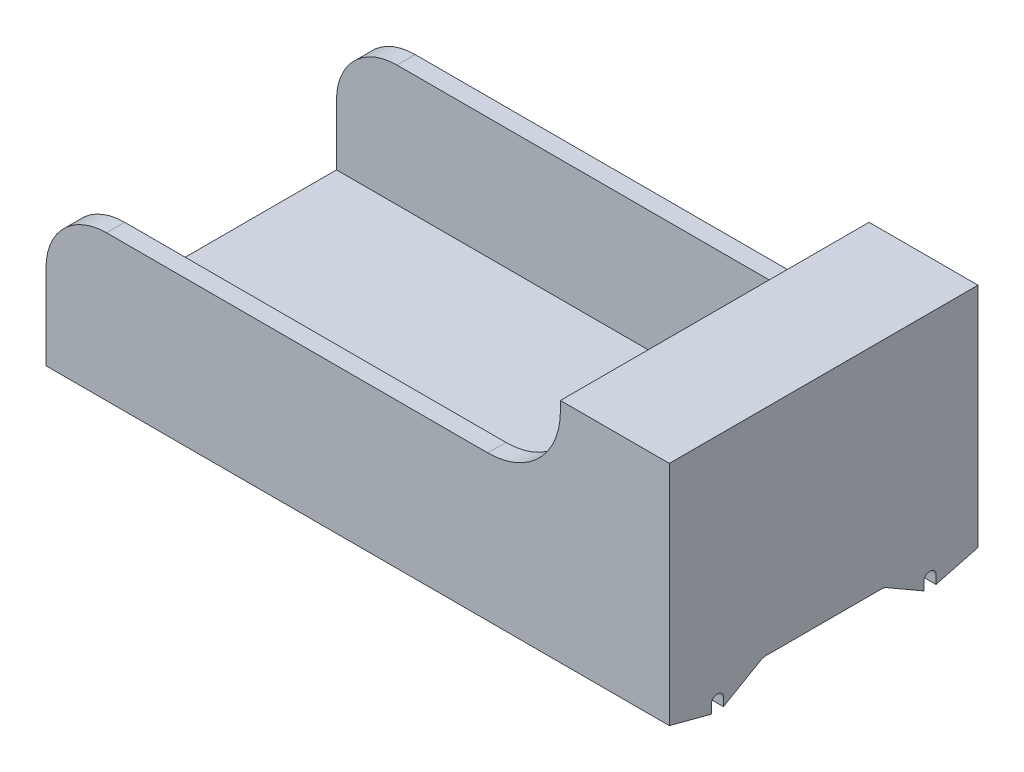
from build123d import *

# Parameters (mm, degrees)
SKETCH1_W                = 100
SKETCH1_H                = 45
BOSS_EXTRUDE1_DEPTH      = 2
BOSS_EXTRUDE2_DEPTH      = 100
BOSS_EXTRUDE3_DEPTH      = 15
CHAMFER2_SIZE            = 2
BOSS_EXTRUDE4_DEPTH      = 3
BOSS_EXTRUDE4_DEPTH_BACK = 48
SKETCH4_W                = 3
SKETCH4_H                = 35.5
BOSS_EXTRUDE6_DEPTH      = 103
CUT_EXTRUDE1_DEPTH       = 108
FILLET1_R                = 12
FILLET2_R                = 10


# Read off the part's stored shape, not the designer's step: Boss-Extrude6
with BuildPart() as part:
    # Sketch1 → Boss-Extrude1 (new body)
    with BuildSketch(Plane(origin=(0, 0, 0), x_dir=(1, 0, 0), z_dir=(0, 1, 0))):
        with Locations((50, 22.5)):
            Rectangle(SKETCH1_W, SKETCH1_H)
    extrude(amount=BOSS_EXTRUDE1_DEPTH)

    # Sketch2 → Boss-Extrude2 (add)
    with BuildSketch(Plane.ZY):
        Polygon((0, 2), (0, 22), (3, 22), (3, 0), (0, 0), align=None)
        Polygon((-45, 2), (-45, 22), (-48, 22), (-48, 0), (-45, 0), align=None)
    extrude(amount=-BOSS_EXTRUDE2_DEPTH)

    # Sketch3 → Boss-Extrude3 (add)
    with BuildSketch(Plane(origin=(100, 0, 0), x_dir=(0, 0, -1), z_dir=(1, 0, 0))):
        Polygon((0, 22), (0, 32.5), (45, 32.5), (45, 22), (48, 22), (48, 35.5), (-3, 35.5), (-3, 22), align=None)
    extrude(amount=-BOSS_EXTRUDE3_DEPTH)

    # Chamfer2
    chamfer2_edges = [part.edges().sort_by_distance(p)[0] for p in [
        (85, 32.5, -22.5),
    ]]
    chamfer(chamfer2_edges, length=CHAMFER2_SIZE)

    # Sketch4 → Boss-Extrude4 (add, two sides: drawn at the far end of the back side and taken through both)
    with BuildSketch(Plane.XY.offset(-BOSS_EXTRUDE4_DEPTH_BACK)):
        with Locations((101.5, 17.75)):
            Rectangle(SKETCH4_W, SKETCH4_H)
    extrude(amount=BOSS_EXTRUDE4_DEPTH + BOSS_EXTRUDE4_DEPTH_BACK)

    # Boss-Extrude6 outline → Boss-Extrude6 (add)
    with BuildSketch(Plane.YZ):
        with BuildLine():
            Line((0, -48), (0, -31.964101615))
            ThreePointArc((0, -31.964101615), (-0.068148347, -32.481739705), (-0.267949192, -32.964101615))
            Line((-0.267949192, -32.964101615), (-3.78757632, -39.060274624))
            ThreePointArc((-3.78757632, -39.060274624), (-4.037826078, -39.794785514), (-3.989674587, -40.569261223))
            Line((-3.989674587, -40.569261223), (-2.034217014, -48))
            Line((-2.034217014, -48), (0, -48))
        make_face()
        with BuildLine():
            ThreePointArc((-3.989674587, -4.430738777), (-4.037826078, -5.205214486), (-3.78757632, -5.939725376))
            Line((-3.78757632, -5.939725376), (-0.267949192, -12.035898385))
            ThreePointArc((-0.267949192, -12.035898385), (-0.068148347, -12.518260295), (0, -13.035898385))
            Line((0, -13.035898385), (0, 3))
            Line((0, 3), (-2.034217014, 3))
            Line((-2.034217014, 3), (-3.989674587, -4.430738777))
        make_face()
    extrude(amount=BOSS_EXTRUDE6_DEPTH)

    # Sketch6 → Cut-Extrude1 (cut)
    with BuildSketch(Plane.ZY):
        with BuildLine():
            Line((-39.060274624, -3.78757632), (-39.060274624, -2.38757632))
            ThreePointArc((-39.060274624, -2.38757632), (-39.323878521, -1.751180217), (-39.960274624, -1.48757632))
            Line((-39.960274624, -1.48757632), (-40.160274624, -1.48757632))
            ThreePointArc((-40.160274624, -1.48757632), (-40.796670727, -1.751180217), (-41.060274624, -2.38757632))
            Line((-41.060274624, -2.38757632), (-41.060274624, -3.860460534))
            Line((-41.060274624, -3.860460534), (-41.060274624, -4.910280297))
            Line((-41.060274624, -4.910280297), (-39.060274624, -4.910280297))
            Line((-39.060274624, -4.910280297), (-39.060274624, -3.78757632))
        make_face()
        with BuildLine():
            Line((-5.939725376, -3.78757632), (-5.939725376, -2.38757632))
            ThreePointArc((-5.939725376, -2.38757632), (-5.676121479, -1.751180217), (-5.039725376, -1.48757632))
            Line((-5.039725376, -1.48757632), (-4.839725376, -1.48757632))
            ThreePointArc((-4.839725376, -1.48757632), (-4.203329273, -1.751180217), (-3.939725376, -2.38757632))
            Line((-3.939725376, -2.38757632), (-3.939725376, -3.860460534))
            Line((-3.939725376, -3.860460534), (-3.939725376, -5.247114717))
            Line((-3.939725376, -5.247114717), (-5.939725376, -5.247114717))
            Line((-5.939725376, -5.247114717), (-5.939725376, -3.78757632))
        make_face()
    extrude(amount=-CUT_EXTRUDE1_DEPTH, mode=Mode.SUBTRACT)

    # Fillet1
    fillet1_edges = [part.edges().sort_by_distance(p)[0] for p in [
        (85, 22, 1.5),
        (85, 22, -46.5),
    ]]
    fillet(fillet1_edges, radius=FILLET1_R)

    # Fillet2
    fillet2_edges = [part.edges().sort_by_distance(p)[0] for p in [
        (0, 22, 1.5),
        (0, 22, -46.5),
    ]]
    fillet(fillet2_edges, radius=FILLET2_R)


solid = part.part
